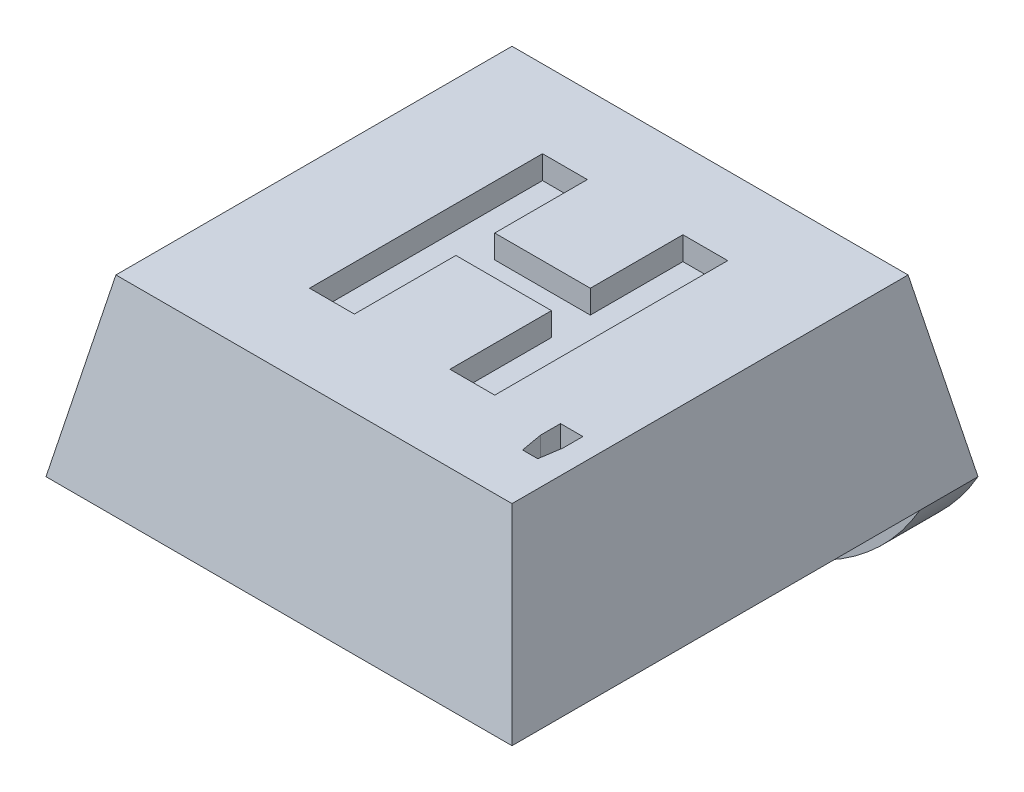
from build123d import *

# Parameters (mm, degrees)
SKETCH1_W               = 8
SKETCH1_H               = 8
BOSS_EXTRUDE1_DEPTH     = 3
CUT_EXTRUDE1_DEPTH      = 12.704699911
CUT_EXTRUDE1_DEPTH_BACK = 12.704699911
CUT_EXTRUDE2_DEPTH      = 11
SKETCH4_R               = 1.75
CUT_EXTRUDE3_DEPTH      = 0.4
SKETCH5_W               = 8
SKETCH5_H               = 1
BOSS_EXTRUDE2_DEPTH     = 2
FILLET1_R               = 4
CUT_EXTRUDE4_DEPTH      = 0.4
CUT_EXTRUDE5_DEPTH      = 0.5


with BuildPart() as part:
    # Sketch1 → Boss-Extrude1 (new body)
    with BuildSketch(Plane(origin=(0, 0, 0), x_dir=(1, 0, 0), z_dir=(0, 1, 0))):
        with Locations((4, 4)):
            Rectangle(SKETCH1_W, SKETCH1_H)
    extrude(amount=BOSS_EXTRUDE1_DEPTH)

    # Sketch2 → Cut-Extrude1 (cut, two sides: drawn at the far end of the back side and taken through both)
    with BuildSketch(Plane.XY.offset(-CUT_EXTRUDE1_DEPTH_BACK)):
        Polygon((0, 0), (0.6, 3), (0, 3), align=None)
        Polygon((8, 0), (7.4, 3), (8, 3), align=None)
    extrude(amount=CUT_EXTRUDE1_DEPTH + CUT_EXTRUDE1_DEPTH_BACK, mode=Mode.SUBTRACT)

    # Sketch3 → Cut-Extrude2 (cut)
    with BuildSketch(Plane(origin=(0, 0, 0), x_dir=(0, 0, -1), z_dir=(1, 0, 0))):
        Polygon((0, 0), (0.6, 3), (0, 3), align=None)
        Polygon((8, 3), (7.4, 3), (8, 0), align=None)
    extrude(amount=CUT_EXTRUDE2_DEPTH, mode=Mode.SUBTRACT)

    # Sketch4 → Cut-Extrude3 (cut)
    with BuildSketch(Plane.XZ):
        with Locations(Location((4, -3.75, 0), (0, 0, 270))):
            Circle(SKETCH4_R)
    extrude(amount=-CUT_EXTRUDE3_DEPTH, mode=Mode.SUBTRACT)

    # Sketch5 → Boss-Extrude2 (add)
    with BuildSketch(Plane.XZ):
        with Locations((4, -7.5)):
            Rectangle(SKETCH5_W, SKETCH5_H)
    extrude(amount=BOSS_EXTRUDE2_DEPTH)

    # Fillet1
    # the kernel refuses this fillet: 4 mm, written as the material it takes off along each edge
    with BuildSketch(Plane(origin=(8, -2, -16.660254038), x_dir=(0, 1, 0), z_dir=(0, 0, 1)), Plane(origin=(0, -2, 1.660254038), x_dir=(0, 1, 0), z_dir=(0, 0, -1))) as fillet1_piece_1:
        with BuildLine():
            CenterArc((4, 3.464101615), FILLET1_R, 180, 60)
            Line((0, 3.464101615), (-0.08, 3.464101615))
            Line((-0.08, 3.464101615), (-0.08, 0))
            Line((-0.08, 0), (0, -0.08))
            ThreePointArc((0, -0.08), (1, -0.08), (1.96, -0.069282032))
            Line((1.96, -0.069282032), (2, 0))
        make_face()
    extrude(amount=18.320508076, mode=Mode.SUBTRACT)

    # Sketch6 → Cut-Extrude4 (cut)
    with BuildSketch(Plane(origin=(0, 3, 0), x_dir=(1, 0, 0), z_dir=(0, 1, 0))):
        Polygon((2.459405501, 2.064543337), (2.459405501, 6.064543337), (3.22863627, 6.064543337), (3.22863627, 4.474799747), (4.869661911, 4.474799747), (4.869661911, 6.064543337), (5.63889268, 6.064543337), (5.63889268, 2.064543337), (4.869661911, 2.064543337), (4.869661911, 3.80813308), (3.22863627, 3.80813308), (3.22863627, 2.064543337), align=None)
    extrude(amount=-CUT_EXTRUDE4_DEPTH, mode=Mode.SUBTRACT)

    # Sketch7 → Cut-Extrude5 (cut)
    with BuildSketch(Plane(origin=(0, 3, 0), x_dir=(1, 0, 0), z_dir=(0, 1, 0))):
        Polygon((6.693034442, 1.488274187), (6.626528032, 1.86447611), (6.626528032, 2.206222905), (7.011143417, 2.206222905), (7.011143417, 1.86447611), (6.953451109, 1.488274187), align=None)
    extrude(amount=-CUT_EXTRUDE5_DEPTH, mode=Mode.SUBTRACT)


solid = part.part
